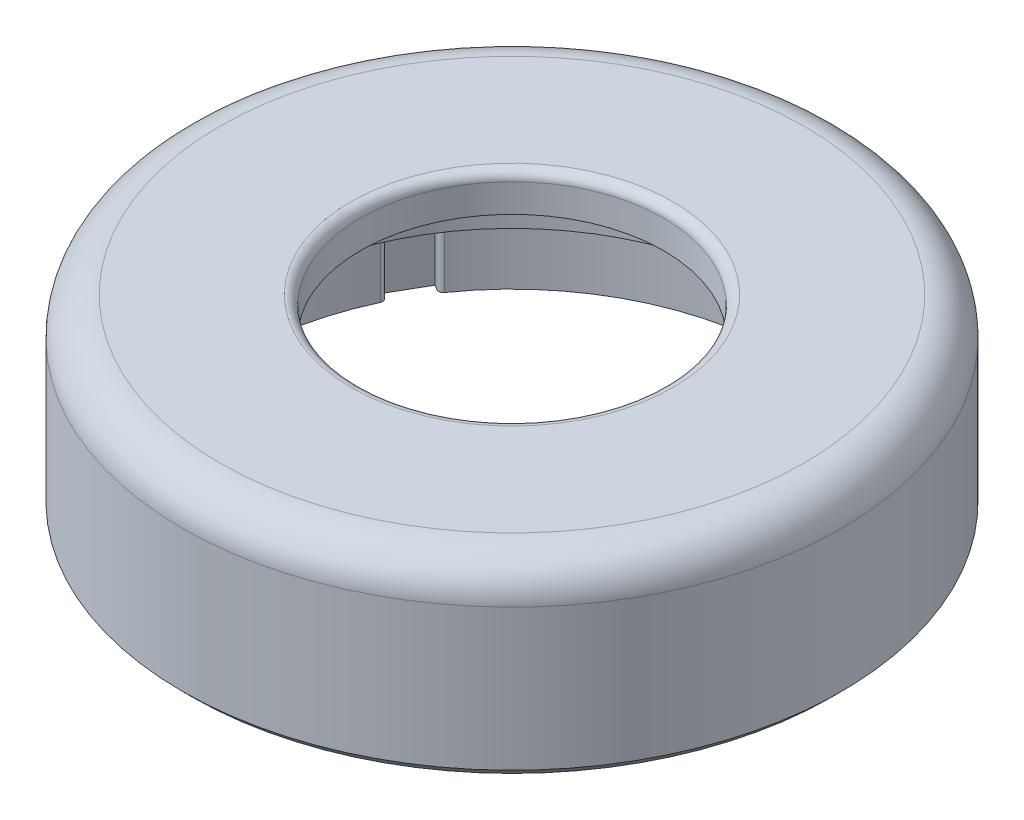
from build123d import *

# Parameters (mm, degrees)
SKETCH7_R            = 35
BOSS_EXTRUDE6_DEPTH  = 20
SKETCH6_R            = 16.1
DISPLAY_CUTOUT_DEPTH = 54.38539126
SKETCH1_R            = 16.1
CUT_EXTRUDE6_DEPTH   = 7
FILLET2_R            = 4
FILLET3_R            = 1
SKETCH8_R            = 27
CUT_EXTRUDE7_DEPTH   = 9
CHAMFER1_SIZE        = 1
FILLET4_R            = 0.5
SKETCH9_R            = 19.85
SKETCH9_R_2          = 17.85
EXTRUDE_THIN1_DEPTH  = 1
FILLET5_R            = 1


with BuildPart() as part:
    # Sketch7 → Boss-Extrude6 (new body)
    with BuildSketch(Plane(origin=(0, 0, 0), x_dir=(1, 0, 0), z_dir=(0, 1, 0))):
        with Locations(Location((0, 0, 0), (0, 0, 270))):
            Circle(SKETCH7_R)
    extrude(amount=BOSS_EXTRUDE6_DEPTH)

    # Sketch6 → Display cutout (cut, through all)
    with BuildSketch(Plane(origin=(0, 0, 0), x_dir=(1, 0, 0), z_dir=(0, 1, 0))):
        with Locations(Location((0, 0, 0), (0, 0, 270))):
            Circle(SKETCH6_R)
    extrude(amount=DISPLAY_CUTOUT_DEPTH, mode=Mode.SUBTRACT)

    # Sketch1 → Cut-Extrude6 (cut)
    with BuildSketch(Plane(origin=(0, 0, 0), x_dir=(1, 0, 0), z_dir=(0, 1, 0))):
        with BuildLine():
            Line((2.04, -30), (2.04, -28.928159292))
            ThreePointArc((2.04, -28.928159292), (25.11473671, -14.5), (26.072520831, 12.697387822))
            Line((26.072520831, 12.697387822), (27.000762114, 13.233308176))
            Line((27.000762114, 13.233308176), (24.960762114, 16.766691824))
            Line((24.960762114, 16.766691824), (24.032520831, 16.23077147))
            ThreePointArc((24.032520831, 16.23077147), (0, 29), (-24.032520831, 16.23077147))
            Line((-24.032520831, 16.23077147), (-24.960762114, 16.766691824))
            Line((-24.960762114, 16.766691824), (-27.000762114, 13.233308176))
            Line((-27.000762114, 13.233308176), (-26.072520831, 12.697387822))
            ThreePointArc((-26.072520831, 12.697387822), (-25.11473671, -14.5), (-2.04, -28.928159292))
            Line((-2.04, -28.928159292), (-2.04, -30))
            Line((-2.04, -30), (2.04, -30))
        make_face()
        with Locations(Location((0, 0, 0), (0, 0, 270))):
            Circle(SKETCH1_R, mode=Mode.SUBTRACT)
    extrude(amount=CUT_EXTRUDE6_DEPTH, mode=Mode.SUBTRACT)

    # Fillet2
    fillet2_edges = [part.edges().sort_by_distance(p)[0] for p in [
        (0, 20, -35),
    ]]
    fillet(fillet2_edges, radius=FILLET2_R)

    # Fillet3
    fillet3_edges = [part.edges().sort_by_distance(p)[0] for p in [
        (0, 20, -16.1),
    ]]
    fillet(fillet3_edges, radius=FILLET3_R)

    # Sketch8 → Cut-Extrude7 (cut)
    with BuildSketch(Plane.XZ.offset(-7)):
        with Locations(Location((0, 0, 0), (0, 0, 270))):
            Circle(SKETCH8_R)
    extrude(amount=-CUT_EXTRUDE7_DEPTH, mode=Mode.SUBTRACT)

    # Chamfer1
    chamfer1_edges = [part.edges().sort_by_distance(p)[0] for p in [
        (0, 0, -35),
    ]]
    chamfer(chamfer1_edges, length=CHAMFER1_SIZE)

    # Fillet4
    fillet4_edges = [part.edges().sort_by_distance(p)[0] for p in [
        (2.04, 3.5, 28.928159292),
        (24.032520831, 3.5, -16.23077147),
        (-26.072520831, 3.5, -12.697387822),
        (-2.04, 3.5, 28.928159292),
        (-24.032520831, 3.5, -16.23077147),
        (26.072520831, 3.5, -12.697387822),
    ]]
    fillet(fillet4_edges, radius=FILLET4_R)

    # Sketch9 → Extrude-Thin1 (add)
    with BuildSketch(Plane.XZ.offset(-16)):
        Circle(SKETCH9_R)
        Circle(SKETCH9_R_2, mode=Mode.SUBTRACT)
    extrude(amount=EXTRUDE_THIN1_DEPTH)

    # Fillet5
    fillet5_edges = [part.edges().sort_by_distance(p)[0] for p in [
        (-17.85, 15, 0),
    ]]
    fillet(fillet5_edges, radius=FILLET5_R - 0.0001)  # a hair under: the kernel refuses the full size


solid = part.part
